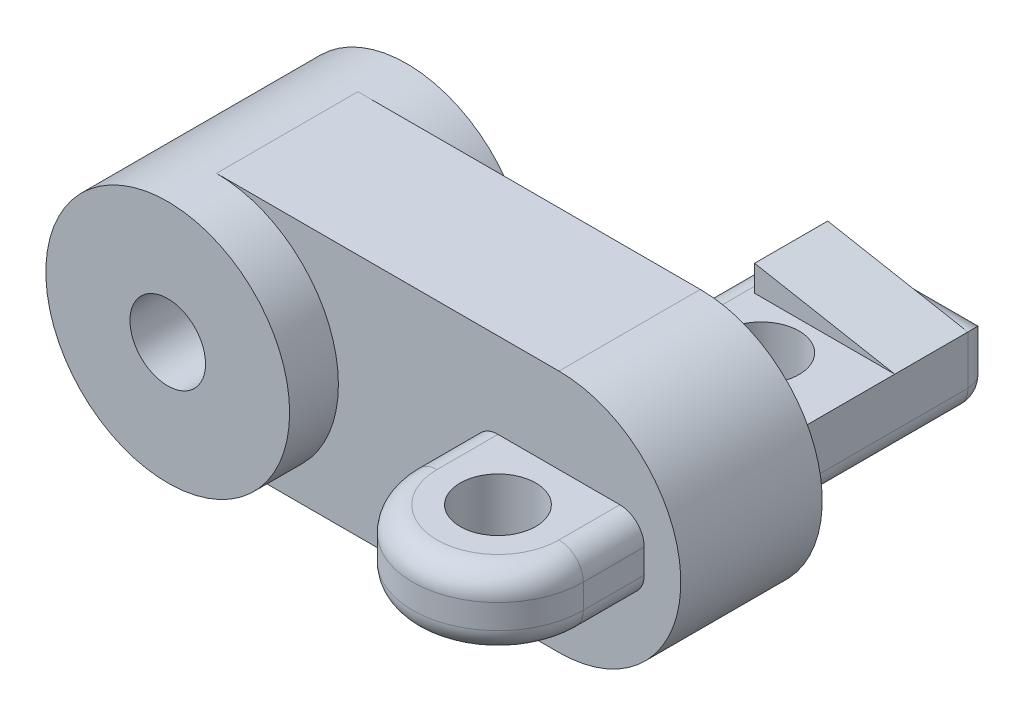
from build123d import *
from build123d.topology import SkipClean

# Parameters (mm, degrees)
ESQUISSE1_R          = 5
ESQUISSE1_R_2        = 1.55
BOSS_EXTRU_1_DEPTH   = 9.8
BOSS_EXTRUDE7_DEPTH  = 9.8
CUT_EXTRUDE3_DEPTH   = 2
SKETCH14_R           = 1.55
BOSS_EXTRUDE11_DEPTH = 1.5
BOSS_EXTRUDE12_DEPTH = 3
BOSS_EXTRUDE17_START = -1
BOSS_EXTRUDE17_DEPTH = 3
FILLET3_R            = 1
FILLET5_R            = 1


with BuildPart() as part:
    # Esquisse1 → Boss.-Extru.1 (new body)
    with BuildSketch(Plane.XY):
        Circle(ESQUISSE1_R)
        Circle(ESQUISSE1_R_2, mode=Mode.SUBTRACT)
    extrude(amount=BOSS_EXTRU_1_DEPTH)

    # Sketch8 → Boss-Extrude7 (add)
    with BuildSketch(Plane(origin=(0, 0, 0), x_dir=(-1, 0, 0), z_dir=(0, 0, -1))):
        with BuildLine():
            Line((0, 5), (-14.046192928, 5))
            ThreePointArc((-14.046192928, 5), (-19.046192928, 0), (-14.046192928, -5))
            Line((-14.046192928, -5), (0, -5))
            ThreePointArc((0, -5), (-5, 0), (0, 5))
        make_face()
    extrude(amount=-BOSS_EXTRUDE7_DEPTH)

    # Sketch12 → Cut-Extrude3 (cut)
    with SkipClean():  # the faces are left unmerged after this step: merging them gives an invalid solid
        with BuildSketch(Plane(origin=(0, 0, 0), x_dir=(-1, 0, 0), z_dir=(0, 0, -1))):
            with BuildLine():
                Line((-14.046192928, 5), (-7.023096464, 5))
                Line((-7.023096464, 5), (0, 5))
                ThreePointArc((0, 5), (-5, 0), (0, -5))
                Line((0, -5), (-7.023096464, -5))
                Line((-7.023096464, -5), (-14.046192928, -5))
                ThreePointArc((-14.046192928, -5), (-19.046192928, 0), (-14.046192928, 5))
            make_face()
        cut_extrude3 = extrude(amount=-CUT_EXTRUDE3_DEPTH, mode=Mode.SUBTRACT)

    # Mirror3: Cut-Extrude3 across plane
    with SkipClean():  # the faces are left unmerged after this step: merging them gives an invalid solid
        add(cut_extrude3.mirror(Plane.XY.offset(4.9)), mode=Mode.SUBTRACT)

    # Sketch14 → Boss-Extrude11 (add, symmetric)
    with SkipClean():  # the faces are left unmerged after this step: merging them gives an invalid solid
        with BuildSketch(Plane(origin=(0, 0, 0), x_dir=(1, 0, 0), z_dir=(0, 1, 0))):
            with BuildLine():
                Line((10.546192928, -2), (17.546192928, -2))
                Line((17.546192928, -2), (17.546192928, 0.5))
                ThreePointArc((17.546192928, 0.5), (14.046192928, 4), (10.546192928, 0.5))
                Line((10.546192928, 0.5), (10.546192928, -2))
            make_face()
            with Locations(Location((14.046192928, 0.5, 0), (0, 0, 180))):
                Circle(SKETCH14_R, mode=Mode.SUBTRACT)
        boss_extrude11 = extrude(amount=BOSS_EXTRUDE11_DEPTH, both=True)

    # Mirror4: Boss-Extrude11 across plane
    with SkipClean():  # the faces are left unmerged after this step: merging them gives an invalid solid
        add(boss_extrude11.mirror(Plane.XY.offset(4.9)))

    # Sketch15 → Boss-Extrude12 (add)
    with SkipClean():  # the faces are left unmerged after this step: merging them gives an invalid solid
        with BuildSketch(Plane(origin=(0, 1.5, 0), x_dir=(1, 0, 0), z_dir=(0, 1, 0))):
            with BuildLine():
                Line((10.546192928, 0.5), (10.546192928, 6.476059904))
                Line((10.546192928, 6.476059904), (17.546192928, 6.476059904))
                Line((17.546192928, 6.476059904), (17.546192928, 0.5))
                ThreePointArc((17.546192928, 0.5), (14.046192928, 4), (10.546192928, 0.5))
            make_face()
        extrude(amount=-BOSS_EXTRUDE12_DEPTH)

    # Sketch23 → Boss-Extrude17 (add)
    with SkipClean():  # the faces are left unmerged after this step: merging them gives an invalid solid
        with BuildSketch(Plane(origin=(0, 0, -6.476059904), x_dir=(-1, 0, 0), z_dir=(0, 0, -1)).offset(BOSS_EXTRUDE17_START)):
            Polygon((-17.546192928, 1.5), (-11.796192928, 2.565699508), (-11.796192928, 1.5), align=None)
        extrude(amount=-BOSS_EXTRUDE17_DEPTH)

    # Fillet3
    fillet3_edges = [part.edges().sort_by_distance(p)[0] for p in [
        (10.546192928, -1.5, 9.05),
        (17.546192928, -1.5, 9.05),
        (14.046192928, -1.5, 13.8),
        (10.546192928, 1.5, 9.05),
        (17.546192928, 1.5, 9.05),
        (14.046192928, 1.5, 13.8),
    ]]
    fillet(fillet3_edges, radius=FILLET3_R)

    # Fillet5
    fillet5_edges = [part.edges().sort_by_distance(p)[0] for p in [
        (14.046192928, -1.5, -6.476059904),
        (14.046192928, 1.5, -6.476059904),
        (17.546192928, 0, -6.476059904),
        (10.546192928, 0, -6.476059904),
        (10.546192928, 1.5, -2.238029952),
        (10.546192928, -1.5, -2.238029952),
        (17.546192928, -1.5, -2.238029952),
    ]]
    fillet(fillet5_edges, radius=FILLET5_R - 0.0001)  # a hair under: the kernel refuses the full size


solid = part.part
